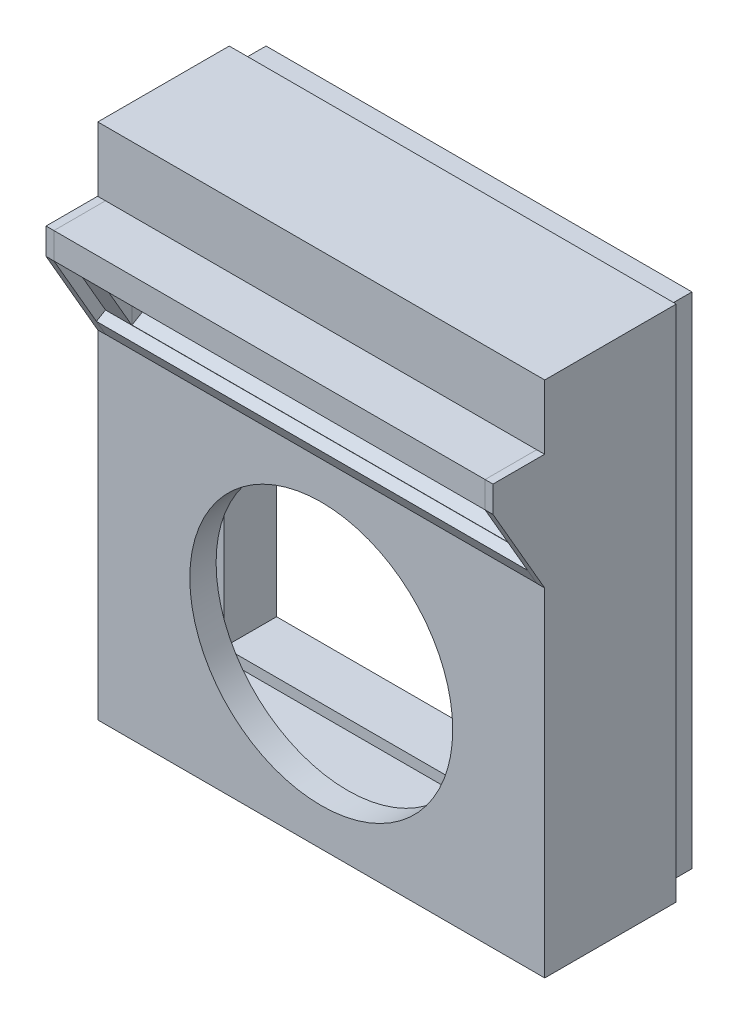
from build123d import *
from build123d.topology import SkipClean

# Parameters (mm, degrees)
SKETCH1_W                  = 2
SKETCH1_H                  = 2
BOSS_EXTRUDE1_DEPTH        = 10
BOSS_EXTRUDE3_DEPTH        = 20
BOSS_EXTRUDE3_DEPTH_BACK   = 5
SKETCH2_W                  = 85
SKETCH2_H                  = 98.49643328
SKETCH2_W_2                = 81
SKETCH2_H_2                = 95
SKETCH3_W                  = 81
SKETCH3_H                  = 95
BOSS_EXTRUDE4_DEPTH        = 2
BOSS_EXTRUDE6_DEPTH        = 41
BOSS_EXTRUDE6_DEPTH_BACK   = 41
BOSS_EXTRUDE6_2_DEPTH      = 41
BOSS_EXTRUDE6_2_DEPTH_BACK = 41
BOSS_EXTRUDE7_DEPTH        = 1.5
SKETCH15_W                 = 72
SKETCH15_H                 = 15
CUT_EXTRUDE2_DEPTH         = 15
CUT_EXTRUDE3_DEPTH         = 10
BOSS_EXTRUDE8_DEPTH        = 5


# Read off the part's stored shape, not the designer's step: Boss-Extrude7
with BuildPart() as part:
    # Sketch1 → Boss-Extrude1 (new body)
    with BuildSketch(Plane.XY):
        Polygon((-49.196743418, -18.776119502), (-47.196743418, -18.776119502), (-47.196743418, 72.223880498), (-24.196743418, 72.223880498), (-22.196743418, 72.223880498), (29.803256582, 72.223880498), (29.803256582, 74.223880498), (-49.196743418, 74.223880498), align=None)
        Polygon((-24.196743418, -18.776119502), (-47.196743418, -18.776119502), (-47.196743418, -20.776119502), (31.803256582, -20.776119502), (31.803256582, 72.223880498), (29.803256582, 72.223880498), (29.803256582, -18.776119502), (-22.196743418, -18.776119502), align=None)
        with Locations((-48.196743418, -19.776119502)):
            Rectangle(SKETCH1_W, SKETCH1_H)
        with Locations((30.803256582, 73.223880498)):
            Rectangle(SKETCH1_W, SKETCH1_H)
    extrude(amount=BOSS_EXTRUDE1_DEPTH)

    # Sketch2 → Boss-Extrude3 (add, two sides: drawn at the far end of the back side and taken through both)
    with BuildSketch(Plane.XY.offset(10).offset(-BOSS_EXTRUDE3_DEPTH_BACK)):
        with Locations((-8.696743418, 26.472097138)):
            Rectangle(SKETCH2_W, SKETCH2_H)
        with Locations((-8.696743418, 26.723880498)):
            Rectangle(SKETCH2_W_2, SKETCH2_H_2, mode=Mode.SUBTRACT)
    extrude(amount=BOSS_EXTRUDE3_DEPTH + BOSS_EXTRUDE3_DEPTH_BACK)

    # Sketch3 → Boss-Extrude4 (add)
    with BuildSketch(Plane.XY.offset(30)):
        with Locations((-8.696743418, 26.723880498)):
            Rectangle(SKETCH3_W, SKETCH3_H)
    extrude(amount=-BOSS_EXTRUDE4_DEPTH)

    # Boss-Extrude7 outline → Boss-Extrude7 (add)
    with BuildSketch(Plane(origin=(32.303256582, 0, 0), x_dir=(0, 0, -1), z_dir=(1, 0, 0))):
        Polygon((-39.842927076, 63.496736875), (-39.842927076, 58.496736875), (-39.765386314, 58.496736875), (-39.823541886, 58.46316074), (-30, 41.448287084), (-30, 45.448287084), (-30.033525999, 45.506355818), (-30.033525999, 63.496736875), align=None)
    boss_extrude7 = extrude(amount=BOSS_EXTRUDE7_DEPTH)

    # Mirror2: Boss-Extrude7 across plane
    add(boss_extrude7.mirror(Plane(origin=(-8.696743418, 0, 0), x_dir=(0, 0, 1), z_dir=(1, 0, 0))))


with BuildPart() as body_2:
    # Sketch9 → Boss-Extrude6 (new, two sides: drawn at the far end of the back side and taken through both)
    with BuildSketch(Plane(origin=(-8.696743418, 0, 0), x_dir=(0, 0, -1), z_dir=(1, 0, 0)).offset(-BOSS_EXTRUDE6_DEPTH_BACK)):
        Polygon((-30.033525999, 45.506355818), (-30.033525999, 63.496736875), (-39.842927076, 63.496736875), (-39.842927076, 58.496736875), (-37.533525999, 58.496736875), align=None)
    extrude(amount=BOSS_EXTRUDE6_DEPTH + BOSS_EXTRUDE6_DEPTH_BACK)


with BuildPart() as body_3:
    # Sketch9 → Boss-Extrude6 2 (new, two sides: drawn at the far end of the back side and taken through both)
    with BuildSketch(Plane(origin=(-8.696743418, 0, 0), x_dir=(0, 0, -1), z_dir=(1, 0, 0)).offset(-BOSS_EXTRUDE6_2_DEPTH_BACK)):
        Polygon((-30.033525999, 41.506355818), (-30.033525999, 45.506355818), (-31.765576807, 44.506355818), align=None)
    extrude(amount=BOSS_EXTRUDE6_2_DEPTH + BOSS_EXTRUDE6_2_DEPTH_BACK)


with BuildPart() as cut_extrude2_tool:
    # Sketch15 → Cut-Extrude2 (new body)
    with BuildSketch(Plane(origin=(0, -1.628309286, 2.820314413), x_dir=(1, 0, 0), z_dir=(0, -0.5000000000000001, 0.8660254037844386))):
        with Locations((-8.696743418, 61.926423172)):
            Rectangle(SKETCH15_W, SKETCH15_H)
    extrude(amount=-CUT_EXTRUDE2_DEPTH)


with BuildPart() as part_1:
    add(part.part)

    # Cut-Extrude2: cut by cut_extrude2_tool
    add(cut_extrude2_tool.part, mode=Mode.SUBTRACT)

    # Sketch16 → Cut-Extrude3 (cut)
    with BuildSketch(Plane.XY.offset(30)):
        with BuildLine():
            ThreePointArc((-8.696743418, 34.365118158), (-33.696743418, 9.365118158), (-8.696743418, -15.634881842))
            Line((-8.696743418, -15.634881842), (-8.696743418, 34.365118158))
        make_face()
        with BuildLine():
            Line((-8.696743418, 34.365118158), (-8.696743418, -15.634881842))
            ThreePointArc((-8.696743418, -15.634881842), (8.980926112, -8.312551372), (16.303256582, 9.365118158))
            ThreePointArc((16.303256582, 9.365118158), (8.980926112, 27.042787688), (-8.696743418, 34.365118158))
        make_face()
    extrude(amount=-CUT_EXTRUDE3_DEPTH, mode=Mode.SUBTRACT)

    # Sketch16<3> → Boss-Extrude8 (add)
    with SkipClean():  # the faces are left unmerged after this step: merging them gives an invalid solid
        with BuildSketch(Plane.XY.offset(30)):
            with BuildLine():
                ThreePointArc((-8.696743418, 37.365118158), (-36.696743418, 9.365118158), (-8.696743418, -18.634881842))
                Line((-8.696743418, -18.634881842), (-8.696743418, -15.634881842))
                ThreePointArc((-8.696743418, -15.634881842), (-33.696743418, 9.365118158), (-8.696743418, 34.365118158))
                Line((-8.696743418, 34.365118158), (-8.696743418, 37.365118158))
            make_face()
            with BuildLine():
                Line((-8.696743418, -15.634881842), (-8.696743418, -18.634881842))
                ThreePointArc((-8.696743418, -18.634881842), (11.102246456, -10.433871715), (19.303256582, 9.365118158))
                ThreePointArc((19.303256582, 9.365118158), (11.102246456, 29.164108031), (-8.696743418, 37.365118158))
                Line((-8.696743418, 37.365118158), (-8.696743418, 34.365118158))
                ThreePointArc((-8.696743418, 34.365118158), (8.980926112, 27.042787688), (16.303256582, 9.365118158))
                ThreePointArc((16.303256582, 9.365118158), (8.980926112, -8.312551372), (-8.696743418, -15.634881842))
            make_face()
        extrude(amount=-BOSS_EXTRUDE8_DEPTH)


with BuildPart() as body_2_1:
    add(body_2.part)

    # Cut-Extrude2: cut by cut_extrude2_tool
    add(cut_extrude2_tool.part, mode=Mode.SUBTRACT)


solid = Compound([body_3.part, part_1.part, body_2_1.part])
